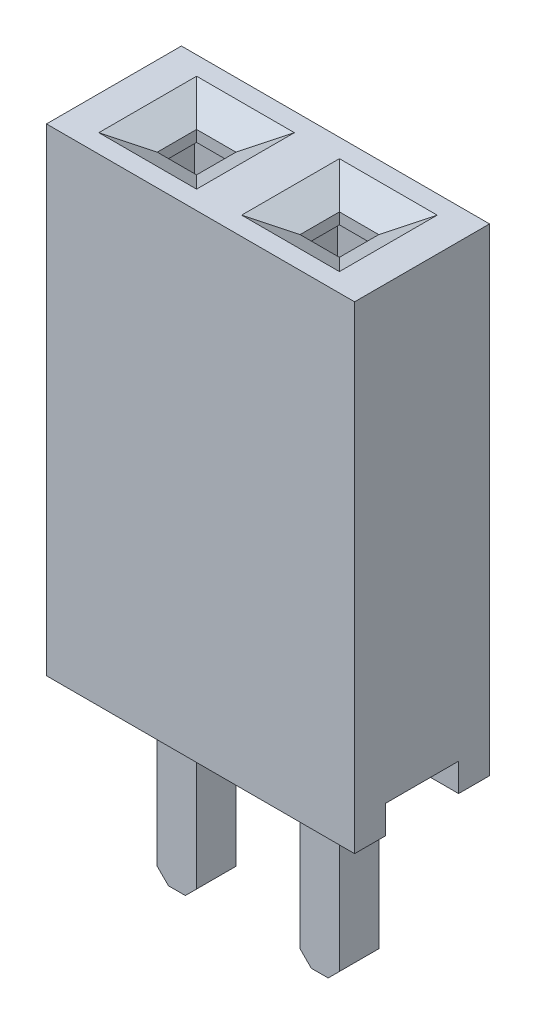
from build123d import *
from OCP.BRepFilletAPI import BRepFilletAPI_MakeChamfer

# Parameters (mm, degrees)
SKETCH8_W              = 5.48
SKETCH8_H              = 2.4
BOSS_EXTRUDE3_DEPTH    = 8.5
SKETCH9_W              = 1.3
SKETCH9_H              = 0.5
CUT_EXTRUDE5_DEPTH     = 11.184321283
SKETCH13_W             = 0.7
SKETCH13_H             = 0.7
CUT_EXTRUDE8_DEPTH     = 10.474708439
CHAMFER4_SIZE          = 0.3
CHAMFER4_SIZE2         = 0.519615242
SKETCH10_W             = 1.373509866
SKETCH10_H             = 1.3
CUT_EXTRUDE6_DEPTH     = 7.5
SKETCH11_W             = 2
SKETCH11_H             = 0.7
CUT_EXTRUDE7_DEPTH     = 6
BOSS_EXTRUDE4_DEPTH    = 0.35
FILLET1_R              = 0.2
FILLET2_SIZE           = 0.4
FILLET2_SIZE_2         = 4.5
CHAMFER5_SIZE          = 0.2
FILLET3_R              = 0.3
LPATTERN17_START       = 1.853245067
LPATTERN17_DEPTH       = 1.373509866
LPATTERN17_START_2     = 1.54
LPATTERN17_2_OUTLINE_W = 6
LPATTERN17_2_OUTLINE_H = 0.7
LPATTERN17_2_DEPTH     = 2
LPATTERN17_START_3     = 1.670384758
LPATTERN17_3_DEPTH     = 1.739230484
LPATTERN17_START_4     = -0.869615242
LPATTERN17_4_DEPTH     = 1.739230484
LPATTERN18_COUNT       = 2
LPATTERN18_PITCH       = 2.54


with BuildPart() as part:
    # Sketch8 → Boss-Extrude3 (new body)
    with BuildSketch(Plane(origin=(0, 0, 0), x_dir=(1, 0, 0), z_dir=(0, 1, 0))):
        with Locations((1.27, 0)):
            Rectangle(SKETCH8_W, SKETCH8_H)
    extrude(amount=BOSS_EXTRUDE3_DEPTH)

    # Sketch9 → Cut-Extrude5 (cut, through all)
    with BuildSketch(Plane.ZY.offset(1.47)):
        with Locations((0, 0.25)):
            Rectangle(SKETCH9_W, SKETCH9_H)
    extrude(amount=-CUT_EXTRUDE5_DEPTH, mode=Mode.SUBTRACT)

    # Sketch13 → Cut-Extrude8 (cut, through all)
    with BuildSketch(Plane(origin=(0, 8.5, 0), x_dir=(1, 0, 0), z_dir=(0, 1, 0))):
        Rectangle(SKETCH13_W, SKETCH13_H)
    extrude(amount=-CUT_EXTRUDE8_DEPTH, mode=Mode.SUBTRACT)

    # Chamfer4: one chamfer whose edges measure the first distance from different faces: ONE call of the kernel's chamfer builder (chamfer() names one face for all edges)
    chamfer4_edges_1 = [part.edges().sort_by_distance(p)[0] for p in [
        (0.35, 8.5, 0),
    ]]
    chamfer4_side_1 = [part.faces().sort_by_distance(p)[0] for p in [
        (0.35, 4.5, 0),
    ]]
    chamfer4_edges_2 = [part.edges().sort_by_distance(p)[0] for p in [
        (0, 8.5, -0.35),
    ]]
    chamfer4_side_2 = [part.faces().sort_by_distance(p)[0] for p in [
        (0, 4.5, -0.35),
    ]]
    chamfer4_edges_3 = [part.edges().sort_by_distance(p)[0] for p in [
        (-0.35, 8.5, 0),
    ]]
    chamfer4_side_3 = [part.faces().sort_by_distance(p)[0] for p in [
        (-0.35, 4.5, 0),
    ]]
    chamfer4_edges_4 = [part.edges().sort_by_distance(p)[0] for p in [
        (0, 8.5, 0.35),
    ]]
    chamfer4_side_4 = [part.faces().sort_by_distance(p)[0] for p in [
        (0, 4.5, 0.35),
    ]]
    chamfer4 = BRepFilletAPI_MakeChamfer(part.part.solid().wrapped)
    for e in chamfer4_edges_1:
        chamfer4.Add(CHAMFER4_SIZE, CHAMFER4_SIZE2, e.wrapped, chamfer4_side_1[0].wrapped)  # the first distance lies on this face
    for e in chamfer4_edges_2:
        chamfer4.Add(CHAMFER4_SIZE, CHAMFER4_SIZE2, e.wrapped, chamfer4_side_2[0].wrapped)  # the first distance lies on this face
    for e in chamfer4_edges_3:
        chamfer4.Add(CHAMFER4_SIZE, CHAMFER4_SIZE2, e.wrapped, chamfer4_side_3[0].wrapped)  # the first distance lies on this face
    for e in chamfer4_edges_4:
        chamfer4.Add(CHAMFER4_SIZE, CHAMFER4_SIZE2, e.wrapped, chamfer4_side_4[0].wrapped)  # the first distance lies on this face
    add(Compound.cast(chamfer4.Shape()), mode=Mode.REPLACE)

    # Sketch10 → Cut-Extrude6 (cut)
    with BuildSketch(Plane.XZ.offset(-0.5)):
        Rectangle(SKETCH10_W, SKETCH10_H)
    extrude(amount=-CUT_EXTRUDE6_DEPTH, mode=Mode.SUBTRACT)

    # Sketch11 → Cut-Extrude7 (cut)
    with BuildSketch(Plane.XZ.offset(-0.5)):
        Rectangle(SKETCH11_W, SKETCH11_H)
    extrude(amount=-CUT_EXTRUDE7_DEPTH, mode=Mode.SUBTRACT)

    # LPattern17: read off the stored shape, not the designer's step
    # LPattern17 outline → LPattern17 (cut)
    with BuildSketch(Plane.YZ.offset(LPATTERN17_START)):
        Polygon((8.5, 0.869615242), (8.2, 0.35), (8, 0.35), (8, 0.65), (0.5, 0.65), (0.5, -0.65), (8, -0.65), (8, -0.35), (8.2, -0.35), (8.5, -0.869615242), align=None)
    extrude(amount=LPATTERN17_DEPTH, mode=Mode.SUBTRACT)

    # LPattern17 2 outline → LPattern17 2 (cut)
    with BuildSketch(Plane.YZ.offset(LPATTERN17_START_2)):
        with Locations((3.5, 0)):
            Rectangle(LPATTERN17_2_OUTLINE_W, LPATTERN17_2_OUTLINE_H)
    extrude(amount=LPATTERN17_2_DEPTH, mode=Mode.SUBTRACT)

    # LPattern17 3 outline → LPattern17 3 (cut)
    with BuildSketch(Plane.YZ.offset(LPATTERN17_START_3)):
        Polygon((8.5, 0.869615242), (8.2, 0.35), (8, 0.35), (8, -0.35), (8.2, -0.35), (8.5, -0.869615242), align=None)
    extrude(amount=LPATTERN17_3_DEPTH, mode=Mode.SUBTRACT)

    # LPattern17 4 outline → LPattern17 4 (add)
    with BuildSketch(Plane.XY.offset(LPATTERN17_START_4)):
        Polygon((1.670384758, 8), (2.19, 8), (2.19, 8.2), (1.670384758, 8.5), align=None)
        Polygon((2.89, 8.2), (2.89, 8), (3.409615242, 8), (3.409615242, 8.5), align=None)
    extrude(amount=LPATTERN17_4_DEPTH)


with BuildPart() as body_2:
    # Sketch12 → Boss-Extrude4 (new, symmetric)
    with BuildSketch(Plane.XY):
        with BuildLine():
            Line((1, 0.5), (1, 6.3))
            Line((1, 6.3), (0.5, 6.3))
            add(Edge.make_bspline(
                [(0.309160803, 5.671259854), (0.5, 5.911486281), (0.5, 6.3)],
                knots=[3.808197993, 3.808197993, 3.808197993, 4.71238898, 4.71238898, 4.71238898], degree=2, weights=[1, 0.899533658, 1]))
            add(Edge.make_bspline(
                [(-0.309160803, 5.671259854), (-1.130943922, 1.7), (0, 1.7), (1.130943922, 1.7), (0.309160803, 5.671259854)],
                knots=[0.757385496, 0.757385496, 0.757385496, 3.141592654, 3.141592654, 5.525799811, 5.525799811, 5.525799811], degree=2, weights=[1, 0.369706154, 1, 0.369706154, 1]))
            add(Edge.make_bspline(
                [(-0.5, 6.3), (-0.5, 5.911486281), (-0.309160803, 5.671259854)],
                knots=[1.570796327, 1.570796327, 1.570796327, 2.474987314, 2.474987314, 2.474987314], degree=2, weights=[1, 0.899533658, 1]))
            Line((-0.5, 6.3), (-1, 6.3))
            Line((-1, 6.3), (-1, 0.5))
            Line((-1, 0.5), (-0.35, 0.5))
            Line((-0.35, 0.5), (-0.35, -3))
            Line((-0.35, -3), (0.35, -3))
            Line((0.35, -3), (0.35, 0.5))
            Line((0.35, 0.5), (1, 0.5))
        make_face()
    extrude(amount=BOSS_EXTRUDE4_DEPTH, both=True)

    # Fillet1
    fillet1_edges = [body_2.edges().sort_by_distance(p)[0] for p in [
        (-0.309160803, 5.671259854, 0.175),
        (0.309160803, 5.671259854, 0.175),
    ]]
    fillet(fillet1_edges, radius=FILLET1_R)

    # Fillet2
    # a fillet whose section is not a circle: 4.5, 0.4 mm, written as the material it takes off along each edge
    with BuildSketch(Plane(origin=(-1, 6.3, -11.6), x_dir=(1, 0, 0), z_dir=(0, 0, 1))) as fillet2_piece_1:
        with BuildLine():
            Bezier((FILLET2_SIZE, 0), (0, 0), (0, -FILLET2_SIZE_2), weights=[1, 0.707106781, 1])
            Line((0, -FILLET2_SIZE_2), (0, 0))
            Line((0, 0), (FILLET2_SIZE, 0))
        make_face()
    extrude(amount=23.2, mode=Mode.SUBTRACT)
    with BuildSketch(Plane(origin=(1, 6.3, -11.6), x_dir=(-1, 0, 0), z_dir=(0, 0, 1))) as fillet2_piece_2:
        with BuildLine():
            Bezier((FILLET2_SIZE, 0), (0, 0), (0, FILLET2_SIZE_2), weights=[1, 0.707106781, 1])
            Line((0, FILLET2_SIZE_2), (0, 0))
            Line((0, 0), (FILLET2_SIZE, 0))
        make_face()
    extrude(amount=23.2, mode=Mode.SUBTRACT)

    # Chamfer5
    chamfer5_edges = [body_2.edges().sort_by_distance(p)[0] for p in [
        (0.35, -3, 0),
        (-0.35, -3, 0),
    ]]
    chamfer(chamfer5_edges, length=CHAMFER5_SIZE)

    # Fillet3
    fillet3_edges = [body_2.edges().sort_by_distance(p)[0] for p in [
        (1, 0.5, 0),
        (-1, 0.5, 0),
    ]]
    fillet(fillet3_edges, radius=FILLET3_R)


with BuildPart() as lpattern18_1:
    # LPattern18: pattern copy
    add(body_2.part.moved(Location(Vector(1, 0, 0) * (1 * LPATTERN18_PITCH))))


solid = Compound([part.part, body_2.part, lpattern18_1.part])
